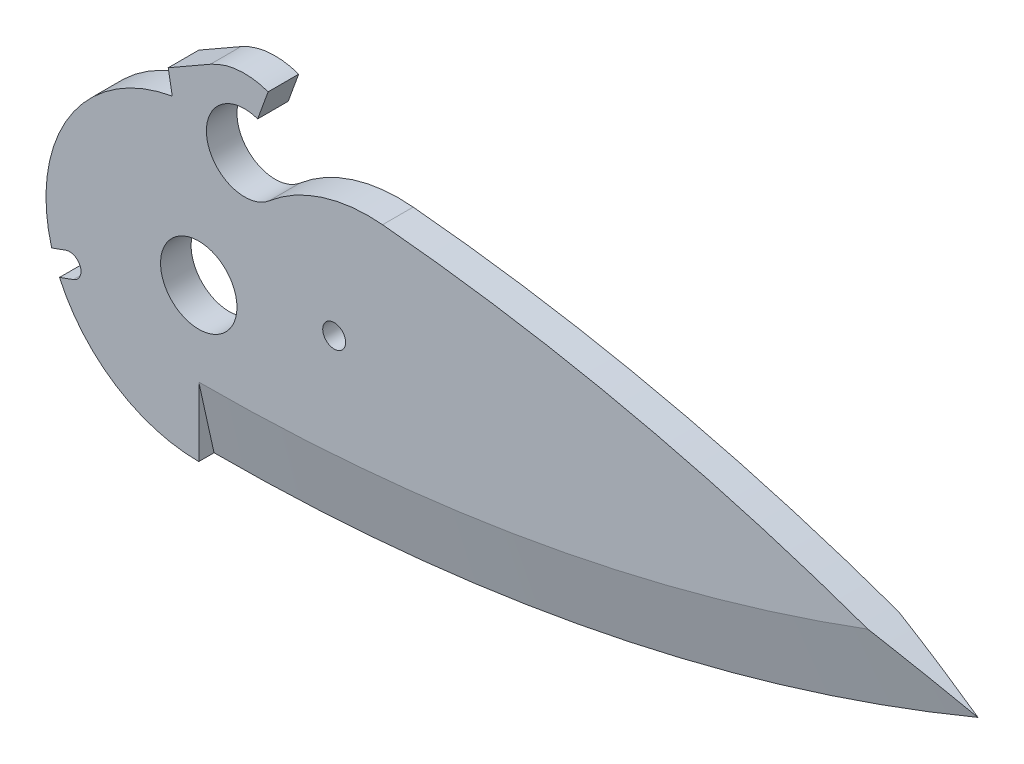
from build123d import *

# Parameters (mm, degrees)
SKICA1_R                      = 2.5
P_IDAT_VYSUNUT_M1_DEPTH       = 1
ODEBRAT_VYSUNUT_M1_DEPTH      = 52.800096525
ODEBRAT_VYSUNUT_M1_DEPTH_BACK = 52.800096525
SKICA4_R                      = 0.75


with BuildPart() as part:
    # Skica1 → Přidat vysunutím1 (new, symmetric)
    with BuildSketch(Plane.XY):
        with BuildLine():
            Line((0.765043164, 12.905760866), (-1.996954043, 11.32528916))
            Line((-1.996954043, 11.32528916), (-1.736481777, 9.84807753))
            ThreePointArc((-1.736481777, 9.84807753), (-7.660444431, 6.427876097), (-10, 0))
            ThreePointArc((-10, 0), (-7.071067812, -7.071067812), (0, -10))
            ThreePointArc((0, -10), (25.495097568, -7.47548784), (50, 0))
            ThreePointArc((50, 0), (31.373196339, 6.157530697), (12.031913616, 9.442006531))
            ThreePointArc((12.031913616, 9.442006531), (8.089430482, 9.018973617), (4.62127636, 7.096985821))
            ThreePointArc((4.62127636, 7.096985821), (0.539624634, 8.556656953), (3.855050358, 11.349231552))
            Line((3.855050358, 11.349231552), (4.539090645, 13.228616794))
            ThreePointArc((4.539090645, 13.228616794), (2.616442408, 13.483623933), (0.765043164, 12.905760866))
        make_face()
        Circle(SKICA1_R, mode=Mode.SUBTRACT)
    extrude(amount=P_IDAT_VYSUNUT_M1_DEPTH, both=True)

    # Skica4 → Odebrat vysunutím1 (cut, two sides: drawn at the far end of the back side and taken through both)
    with BuildSketch(Plane.XY.offset(-ODEBRAT_VYSUNUT_M1_DEPTH_BACK)):
        with Locations((8.863269777, 1.562833599)):
            Circle(SKICA4_R)
        with BuildLine():
            Line((-8.713748695, -2.373411824), (-9.62697519, -2.705799086))
            ThreePointArc((-9.62697519, -2.705799086), (-9.396926208, -3.420201433), (-9.113944975, -4.115338017))
            Line((-9.113944975, -4.115338017), (-8.20071848, -3.782950756))
            ThreePointArc((-8.20071848, -3.782950756), (-7.752464121, -2.821666182), (-8.713748695, -2.373411824))
        make_face()
    extrude(amount=ODEBRAT_VYSUNUT_M1_DEPTH + ODEBRAT_VYSUNUT_M1_DEPTH_BACK, mode=Mode.SUBTRACT)

    # Odebrat tažením po křivce1: sweep along a path in Skica3
    with BuildLine(Plane.XY) as odebrat_ta_en_m_po_k_ivce1_path:
        ThreePointArc((0, -10), (25.495097568, -7.47548784), (50, 0))
    # Skica2 → Odebrat tažením po křivce1 (sweep, cut)
    with BuildSketch(Plane(origin=(0, 0, 0), x_dir=(0, 0, -1), z_dir=(1, 0, 0))):
        Polygon((0, -10), (-1, -5.489291496), (-1, -10), align=None)
    odebrat_ta_en_m_po_k_ivce1 = sweep(path=odebrat_ta_en_m_po_k_ivce1_path.line, mode=Mode.SUBTRACT)

    # Zrcadlit1: Odebrat tažením po křivce1 across plane
    add(odebrat_ta_en_m_po_k_ivce1.mirror(Plane.XY), mode=Mode.SUBTRACT)


solid = part.part
